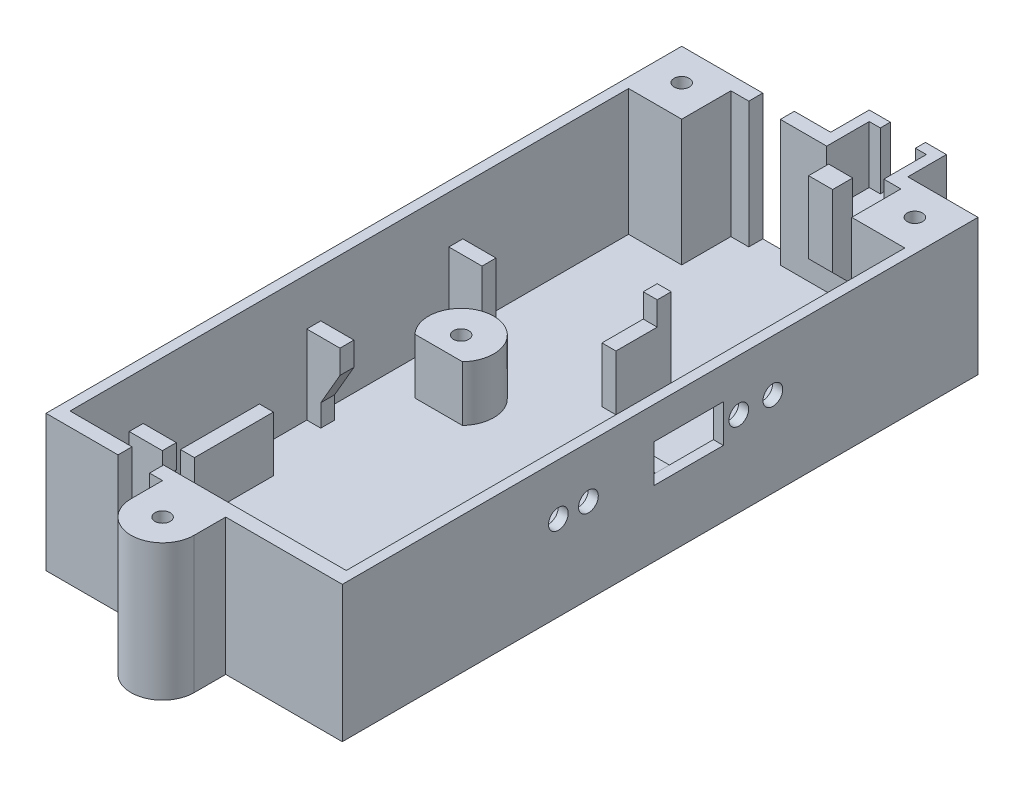
from build123d import *

# Parameters (mm, degrees)
BOSS_EXTRUDE1_DEPTH            = 77
SKETCH3_W                      = 37.54
SKETCH3_H                      = 17.27
BOSS_EXTRUDE2_DEPTH            = 1.77
SKETCH4_W                      = 37.54
SKETCH4_H                      = 17.27
BOSS_EXTRUDE3_DEPTH            = 1.77
SKETCH5_W                      = 4
SKETCH5_H                      = 16
CUT_EXTRUDE2_DEPTH             = 1.77
SKETCH6_W                      = 9.78
SKETCH6_H                      = 11.05
SKETCH6_W_2                    = 7.24
SKETCH6_H_2                    = 7.24
BUTTON_WALLS_DEPTH             = 7.24
SKETCH7_W                      = 9.78
SKETCH7_H                      = 11.05
BUTTON_BOTTOM_DEPTH            = 1.27
SKETCH8_W                      = 7.24
SKETCH8_H                      = 1.77
BUTTON_CUTOUT_MIDDLE_DEPTH     = 7.24
SKETCH9_W                      = 4.45
SKETCH9_H                      = 1.27
SKETCH9_W_2                    = 3.37
SKETCH9_H_2                    = 4.39
BUTTON_CUTOUT_FRONT_BACK_DEPTH = 7.24
SKETCH10_W                     = 3.37
SKETCH10_H                     = 4.39
BUTTON_CUTOUT_BOTTOM_DEPTH     = 1.27
BUTTON_CHAMFER1_SIZE           = 5
SKETCH12_W                     = 35
SKETCH12_H                     = 1.77
SKETCH12_W_2                   = 1.77
SKETCH12_H_2                   = 10
SKETCH12_W_3                   = 7.5
SKETCH12_R                     = 0.9652
SKETCH12_H_3                   = 7
SUPPORT_PCB_BATTERY_DEPTH      = 7
SKETCH13_R                     = 1.25
SKETCH13_W                     = 8.8
SKETCH13_H                     = 4.8
CUTOUT_USB_3_LEDS_DEPTH        = 1.77
SKETCH16_W                     = 1.77
SKETCH16_H                     = 1.77
TAB_PCB_RETAINER_LEN_DEPTH     = 3
SKETCH17_W                     = 4
SKETCH17_H                     = 1.77
CUTOUT_BACK_MOT_WIRES_DEPTH    = 9
SKETCH18_R                     = 1.25
CUTOUT_CHG_DONE_LED_DEPTH      = 10
SKETCH19_W                     = 4.2
SKETCH19_H                     = 1.77
TAB_PCB_RETAINERS_WIDTH_DEPTH  = 10
CUTOUT_RETAINER_TAB_1_DEPTH    = 1.77
CUTOUT_RETAINER_TAB_2_DEPTH    = 1.77
SKETCH23_W                     = 8
SKETCH23_H                     = 8
SKETCH23_R                     = 0.9652
CASING_SCREW_POSTS_DEPTH       = 17.27


with BuildPart() as part:
    # Sketch2 → Boss-Extrude1 (new body)
    with BuildSketch(Plane.XY):
        Polygon((-30.215355805, 3.088014981), (-30.215355805, -12.911985019), (4.784644195, -12.911985019), (4.784644195, 3.088014981), (6.054644195, 3.088014981), (6.054644195, -14.181985019), (-31.485355805, -14.181985019), (-31.485355805, 3.088014981), align=None)
    extrude(amount=BOSS_EXTRUDE1_DEPTH)

    # Sketch3 → Boss-Extrude2 (add)
    with BuildSketch(Plane.XY.offset(77)):
        with Locations((-12.715355805, -5.546985019)):
            Rectangle(SKETCH3_W, SKETCH3_H)
    extrude(amount=BOSS_EXTRUDE2_DEPTH)

    # Sketch4 → Boss-Extrude3 (add)
    with BuildSketch(Plane(origin=(0, 0, 0), x_dir=(-1, 0, 0), z_dir=(0, 0, -1))):
        with Locations((12.715355805, -5.546985019)):
            Rectangle(SKETCH4_W, SKETCH4_H)
    extrude(amount=BOSS_EXTRUDE3_DEPTH)

    # Sketch5 → Cut-Extrude2 (cut)
    with BuildSketch(Plane(origin=(0, 0, -1.77), x_dir=(-1, 0, 0), z_dir=(0, 0, -1))):
        with Locations((19.215355805, -4.911985019)):
            Rectangle(SKETCH5_W, SKETCH5_H)
    extrude(amount=-CUT_EXTRUDE2_DEPTH, mode=Mode.SUBTRACT)

    # Sketch6 → button_walls (add)
    with BuildSketch(Plane(origin=(0, 3.088014981, 0), x_dir=(1, 0, 0), z_dir=(0, 1, 0))):
        with Locations((-7.725355805, 1.135)):
            Rectangle(SKETCH6_W, SKETCH6_H)
        with Locations((-7.725355805, 1.77)):
            Rectangle(SKETCH6_W_2, SKETCH6_H_2, mode=Mode.SUBTRACT)
    extrude(amount=-BUTTON_WALLS_DEPTH)

    # Sketch7 → button_bottom (add)
    with BuildSketch(Plane.XZ.offset(4.151985019)):
        with Locations((-7.725355805, -1.135)):
            Rectangle(SKETCH7_W, SKETCH7_H)
    extrude(amount=BUTTON_BOTTOM_DEPTH)

    # Sketch8 → button_cutout_middle (cut)
    with BuildSketch(Plane(origin=(0, 3.088014981, 0), x_dir=(1, 0, 0), z_dir=(0, 1, 0))):
        with Locations((-7.725355805, 0.885)):
            Rectangle(SKETCH8_W, SKETCH8_H)
    extrude(amount=-BUTTON_CUTOUT_MIDDLE_DEPTH, mode=Mode.SUBTRACT)

    # Sketch9 → button_cutout_front_back (cut)
    with BuildSketch(Plane(origin=(0, 3.088014981, 0), x_dir=(1, 0, 0), z_dir=(0, 1, 0))):
        with Locations((-7.720355805, 6.025)):
            Rectangle(SKETCH9_W, SKETCH9_H)
        with Locations((-10.930355805, -2.195)):
            Rectangle(SKETCH9_W_2, SKETCH9_H_2)
        with Locations((-4.520355805, -2.195)):
            Rectangle(SKETCH9_W_2, SKETCH9_H_2)
    extrude(amount=-BUTTON_CUTOUT_FRONT_BACK_DEPTH, mode=Mode.SUBTRACT)

    # Sketch10 → button_cutout_bottom (cut)
    with BuildSketch(Plane(origin=(0, -4.151985019, 0), x_dir=(1, 0, 0), z_dir=(0, 1, 0))):
        with Locations((-10.930355805, -2.195)):
            Rectangle(SKETCH10_W, SKETCH10_H)
        with Locations((-4.520355805, -2.195)):
            Rectangle(SKETCH10_W, SKETCH10_H)
    extrude(amount=-BUTTON_CUTOUT_BOTTOM_DEPTH, mode=Mode.SUBTRACT)

    # button_Chamfer1
    # the kernel refuses this chamfer: 5 mm, written as the material it adds along each edge
    with BuildSketch(Plane(origin=(-6.205355805, -5.421985019, 0), x_dir=(0, -0.9996219169112968, -0.027495876610586372), z_dir=(-1, 0, 0))) as button_chamfer1_piece_1_section:
        Polygon((BUTTON_CHAMFER1_SIZE * 0.999621916911, BUTTON_CHAMFER1_SIZE * 0.0274958766106), (-BUTTON_CHAMFER1_SIZE * 0.0274958766106, BUTTON_CHAMFER1_SIZE * 0.999621916911), (0, 0), align=None)
    button_chamfer1_piece_1 = extrude(amount=3.04, mode=Mode.PRIVATE)
    button_chamfer1_piece_1 = split(button_chamfer1_piece_1, bisect_by=Plane(origin=(-7.725355805, -7.110612501, 4.39), z_dir=(0, 0, -1)), keep=Keep.TOP, mode=Mode.PRIVATE)
    add(button_chamfer1_piece_1)

    # Sketch12 → support_pcb_battery (add)
    # profile 1 of 5: a face of its own
    with BuildSketch(Plane(origin=(0, -12.911985019, 0), x_dir=(1, 0, 0), z_dir=(0, 1, 0))):
        with Locations((-12.715355805, -76.115)):
            Rectangle(SKETCH12_W, SKETCH12_H)
    # profile 2 of 5: a face of its own
    with BuildSketch(Plane(origin=(0, -12.911985019, 0), x_dir=(1, 0, 0), z_dir=(0, 1, 0))):
        with Locations((-27.100355805, -60.23)):
            Rectangle(SKETCH12_W_2, SKETCH12_H_2)
    # profile 3 of 5: a face of its own
    with BuildSketch(Plane(origin=(0, -12.911985019, 0), x_dir=(1, 0, 0), z_dir=(0, 1, 0))):
        with Locations((1.034644195, -36.845)):
            Rectangle(SKETCH12_W_3, SKETCH12_H)
    # profile 4 of 5: a face of its own
    with BuildSketch(Plane(origin=(0, -12.911985019, 0), x_dir=(1, 0, 0), z_dir=(0, 1, 0))):
        with BuildLine():
            Line((-25.783918863, -37.73), (-19.764792747, -37.73))
            ThreePointArc((-19.764792747, -37.73), (-22.774355805, -30.7466), (-25.783918863, -37.73))
        make_face()
        with Locations(Location((-22.774355805, -34.8868, 0), (0, 0, 270))):
            Circle(SKETCH12_R, mode=Mode.SUBTRACT)
    # profile 5 of 5: a face of its own
    with BuildSketch(Plane(origin=(0, -12.911985019, 0), x_dir=(1, 0, 0), z_dir=(0, 1, 0))):
        with Locations((-12.100355805, -23.33)):
            Rectangle(SKETCH12_W_2, SKETCH12_H_3)
    extrude(amount=SUPPORT_PCB_BATTERY_DEPTH)

    # Sketch13 → cutout_usb_3_leds (cut)
    with BuildSketch(Plane(origin=(6.054644195, 0, 0), x_dir=(0, 0, -1), z_dir=(1, 0, 0))):
        with Locations((-51.3968, -3.411985019)):
            Circle(SKETCH13_R)
        with Locations((-47.5868, -3.411985019)):
            Circle(SKETCH13_R)
        with Locations((-24.2188, -3.411985019)):
            Circle(SKETCH13_R)
        with Locations((-34.8868, -3.411985019)):
            Rectangle(SKETCH13_W, SKETCH13_H)
    extrude(amount=-CUTOUT_USB_3_LEDS_DEPTH, mode=Mode.SUBTRACT)

    # Sketch16 → tab_pcb_retainer_len (add)
    with BuildSketch(Plane(origin=(0, -5.911985019, 0), x_dir=(1, 0, 0), z_dir=(0, 1, 0))):
        with Locations((-12.100355805, -20.715)):
            Rectangle(SKETCH16_W, SKETCH16_H)
    extrude(amount=TAB_PCB_RETAINER_LEN_DEPTH)

    # Sketch17 → cutout_back_mot_wires (cut)
    with BuildSketch(Plane(origin=(0, 3.088014981, 0), x_dir=(1, 0, 0), z_dir=(0, 1, 0))):
        with Locations((-20.361355805, -77.885)):
            Rectangle(SKETCH17_W, SKETCH17_H)
    extrude(amount=-CUTOUT_BACK_MOT_WIRES_DEPTH, mode=Mode.SUBTRACT)

    # Sketch18 → cutout_chg_done_led (cut)
    with BuildSketch(Plane(origin=(6.054644195, 0, 0), x_dir=(0, 0, -1), z_dir=(1, 0, 0))):
        with Locations((-28.5368, -3.411985019)):
            Circle(SKETCH18_R)
    extrude(amount=-CUTOUT_CHG_DONE_LED_DEPTH, mode=Mode.SUBTRACT)

    # Sketch19 → tab_pcb_retainers_width (add)
    with BuildSketch(Plane(origin=(0, -12.911985019, 0), x_dir=(1, 0, 0), z_dir=(0, 1, 0))):
        with Locations((-28.115355805, -68.615)):
            Rectangle(SKETCH19_W, SKETCH19_H)
        with Locations((-28.115355805, -46.115)):
            Rectangle(SKETCH19_W, SKETCH19_H)
        with Locations((-28.115355805, -28.115)):
            Rectangle(SKETCH19_W, SKETCH19_H)
    extrude(amount=TAB_PCB_RETAINERS_WIDTH_DEPTH)

    # Sketch20 → cutout_retainer_tab_1 (cut)
    with BuildSketch(Plane.XY.offset(69.5)):
        Polygon((-26.015355805, -12.911985019), (-26.015355805, -5.911985019), (-28.445355805, -10.120868481), (-28.445355805, -12.911985019), align=None)
    extrude(amount=-CUTOUT_RETAINER_TAB_1_DEPTH, mode=Mode.SUBTRACT)

    # Sketch21 → cutout_retainer_tab_2 (cut)
    with BuildSketch(Plane.XY.offset(47)):
        Polygon((-26.015355805, -5.911985019), (-28.445355805, -10.120868481), (-28.445355805, -12.911985019), (-26.015355805, -12.911985019), align=None)
    extrude(amount=-CUTOUT_RETAINER_TAB_2_DEPTH, mode=Mode.SUBTRACT)

    # Sketch23 → casing_screw_posts (add)
    # profile 1 of 3: a face of its own
    with BuildSketch(Plane.XZ.offset(14.181985019)):
        with Locations((2.054644195, 2.23)):
            Rectangle(SKETCH23_W, SKETCH23_H)
        with Locations(Location((2.054644195, 2.23, 0), (0, 0, 270))):
            Circle(SKETCH23_R, mode=Mode.SUBTRACT)
    # profile 2 of 3: a face of its own
    with BuildSketch(Plane.XZ.offset(14.181985019)):
        with Locations((-27.485355805, 2.23)):
            Rectangle(SKETCH23_W, SKETCH23_H)
        with Locations(Location((-27.485355805, 2.23, 0), (0, 0, 270))):
            Circle(SKETCH23_R, mode=Mode.SUBTRACT)
    # profile 3 of 3: a face of its own
    with BuildSketch(Plane.XZ.offset(14.181985019)):
        with BuildLine():
            Line((-16.715355805, 82.77), (-16.715355805, 78.77))
            Line((-16.715355805, 78.77), (-8.715355805, 78.77))
            Line((-8.715355805, 78.77), (-8.715355805, 82.77))
            ThreePointArc((-8.715355805, 82.77), (-12.715355805, 86.77), (-16.715355805, 82.77))
        make_face()
        with Locations(Location((-12.715355805, 82.77, 0), (0, 0, 270))):
            Circle(SKETCH23_R, mode=Mode.SUBTRACT)
    extrude(amount=-CASING_SCREW_POSTS_DEPTH)


solid = part.part
